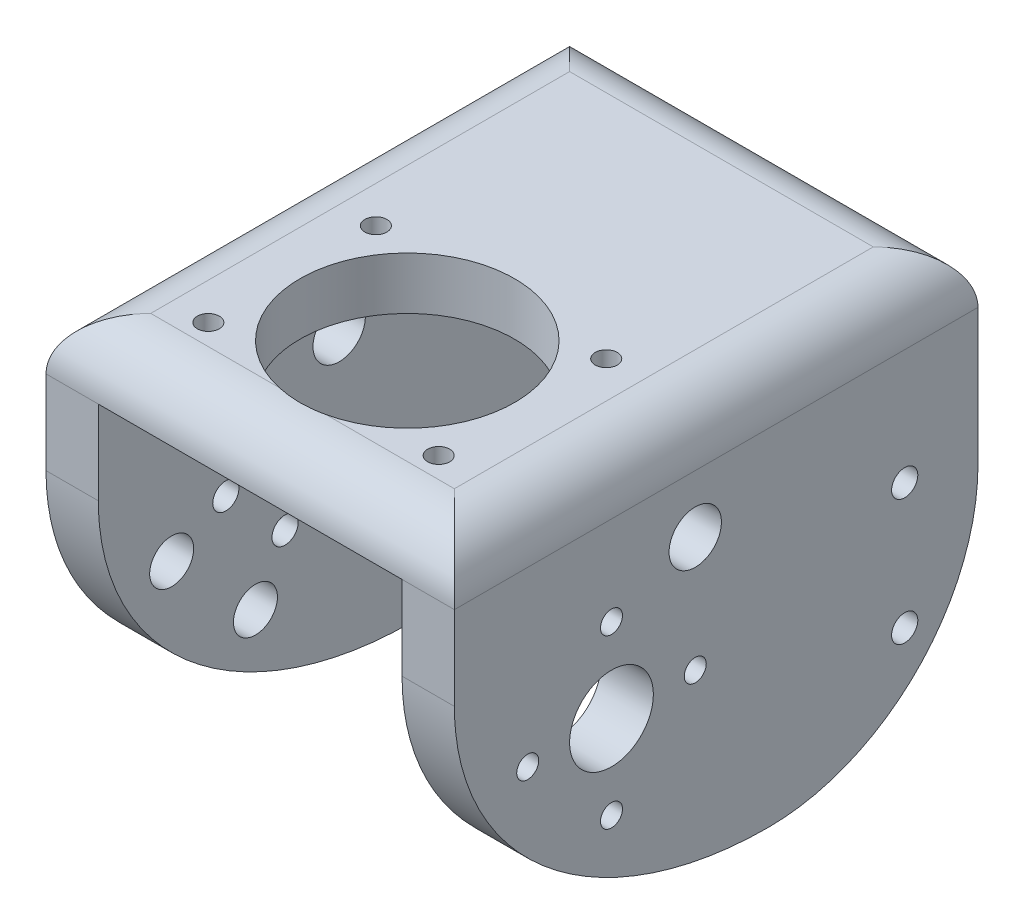
from build123d import *

# Parameters (mm, degrees)
SKETCH1_W               = 30
SKETCH1_H               = 33
SKETCH1_R               = 1.05
SKETCH1_R_2             = 4
BOSS_EXTRUDE1_DEPTH     = 5
SKETCH2_W               = 39
SKETCH2_H               = 30
SKETCH2_R               = 10.25
SKETCH2_R_2             = 1.05
BOSS_EXTRUDE2_DEPTH     = 5
SKETCH3_W               = 30
SKETCH3_H               = 38
SKETCH3_R               = 1.25
BOSS_EXTRUDE3_DEPTH     = 5
BOSS_EXTRUDE5_DEPTH     = 20
SKETCH5_R               = 1.25
CUT_EXTRUDE1_DEPTH      = 57.641415943
SKETCH7_R               = 2.5
CUT_EXTRUDE2_DEPTH      = 57.641415943
FILLET1_SIZE            = 25
FILLET1_SIZE_2          = 30
FILLET2_R               = 20
FILLET3_START           = -34
FILLET3_DEPTH           = 39
FILLET3_START_2         = -36
FILLET3_2_DEPTH         = 52
CUT_EXTRUDE3_DEPTH      = 54.322134411
CUT_EXTRUDE3_DEPTH_BACK = 2
SKETCH8_R               = 2.1


with BuildPart() as part:
    # Sketch1 → Boss-Extrude1 (new body)
    with BuildSketch(Plane(origin=(0, 0, 0), x_dir=(0, 0, -1), z_dir=(1, 0, 0))):
        Rectangle(SKETCH1_W, SKETCH1_H)
        with Locations((0, 8)):
            Circle(SKETCH1_R, mode=Mode.SUBTRACT)
        with Locations((8, 0)):
            Circle(SKETCH1_R, mode=Mode.SUBTRACT)
        with Locations((0, -8)):
            Circle(SKETCH1_R, mode=Mode.SUBTRACT)
        with Locations((-8, 0)):
            Circle(SKETCH1_R, mode=Mode.SUBTRACT)
        Circle(SKETCH1_R_2, mode=Mode.SUBTRACT)
    extrude(amount=BOSS_EXTRUDE1_DEPTH)

    # Sketch2 → Boss-Extrude2 (add)
    with BuildSketch(Plane(origin=(0, 16.5, 0), x_dir=(1, 0, 0), z_dir=(0, 1, 0))):
        with Locations((-14.5, 0)):
            Rectangle(SKETCH2_W, SKETCH2_H)
        with Locations(Location((-14.5, 0, 0), (0, 0, 270))):
            Circle(SKETCH2_R, mode=Mode.SUBTRACT)
        with Locations(Location((-25.5, 8, 0), (0, 0, 270))):
            Circle(SKETCH2_R_2, mode=Mode.SUBTRACT)
        with Locations(Location((-3.5, 8, 0), (0, 0, 270))):
            Circle(SKETCH2_R_2, mode=Mode.SUBTRACT)
        with Locations(Location((-3.5, -8, 0), (0, 0, 270))):
            Circle(SKETCH2_R_2, mode=Mode.SUBTRACT)
        with Locations(Location((-25.5, -8, 0), (0, 0, 270))):
            Circle(SKETCH2_R_2, mode=Mode.SUBTRACT)
    extrude(amount=BOSS_EXTRUDE2_DEPTH)

    # Sketch3 → Boss-Extrude3 (add)
    with BuildSketch(Plane.ZY.offset(34)):
        with Locations((0, 2.5)):
            Rectangle(SKETCH3_W, SKETCH3_H)
        with Locations((2.828427125, 2.828427125)):
            Circle(SKETCH3_R, mode=Mode.SUBTRACT)
        with Locations((-2.828427125, -2.828427125)):
            Circle(SKETCH3_R, mode=Mode.SUBTRACT)
    extrude(amount=-BOSS_EXTRUDE3_DEPTH)

    # Sketch6 → Boss-Extrude5 (add)
    with BuildSketch(Plane(origin=(0, 0, -15), x_dir=(-1, 0, 0), z_dir=(0, 0, -1))):
        Polygon((0, 16.5), (29, 16.5), (29, -16.5), (34, -16.5), (34, 21.5), (-5, 21.5), (-5, -16.5), (0, -16.5), align=None)
    extrude(amount=BOSS_EXTRUDE5_DEPTH)

    # Sketch5 → Cut-Extrude1 (cut, through all)
    with BuildSketch(Plane.ZY.offset(34)):
        with Locations((-28, -6.5)):
            Circle(SKETCH5_R)
        with Locations((-28, 5.5)):
            Circle(SKETCH5_R)
    extrude(amount=-CUT_EXTRUDE1_DEPTH, mode=Mode.SUBTRACT)

    # Sketch7 → Cut-Extrude2 (cut, through all)
    with BuildSketch(Plane.ZY.offset(34)):
        with Locations((-8, 11)):
            Circle(SKETCH7_R)
    extrude(amount=-CUT_EXTRUDE2_DEPTH, mode=Mode.SUBTRACT)

    # Fillet1
    # a fillet whose section is not a circle: 30, 25 mm, written as the material it takes off along each edge
    with BuildSketch(Plane(origin=(-109, -16.5, 15), x_dir=(0, 1, 0), z_dir=(1, 0, 0))) as fillet1_piece_1:
        with BuildLine():
            Bezier((FILLET1_SIZE, 0), (0, 0), (0, -FILLET1_SIZE_2), weights=[1, 0.707106781, 1])
            Line((0, -FILLET1_SIZE_2), (0, 0))
            Line((0, 0), (FILLET1_SIZE, 0))
        make_face()
    extrude(amount=155, mode=Mode.SUBTRACT)
    with BuildSketch(Plane(origin=(-75, -16.5, 15), x_dir=(0, 0, -1), z_dir=(1, 0, 0))) as fillet1_piece_2:
        with BuildLine():
            Bezier((FILLET1_SIZE_2, 0), (0, 0), (0, FILLET1_SIZE), weights=[1, 0.707106781, 1])
            Line((0, FILLET1_SIZE), (0, 0))
            Line((0, 0), (FILLET1_SIZE_2, 0))
        make_face()
    extrude(amount=155, mode=Mode.SUBTRACT)

    # Fillet2
    fillet2_edges = [part.edges().sort_by_distance(p)[0] for p in [
        (2.5, -16.5, -35),
        (-31.5, -16.5, -35),
    ]]
    fillet(fillet2_edges, radius=FILLET2_R - 0.0001)  # a hair under: the kernel refuses the full size

    # Fillet3: read off the stored shape, not the designer's step
    # Fillet3 outline → Fillet3 (cut)
    with BuildSketch(Plane.YZ.offset(FILLET3_START)):
        with BuildLine():
            Line((21.5, 15), (16.5, 15))
            ThreePointArc((16.5, 15), (20.035533906, 13.535533906), (21.5, 10))
            Line((21.5, 10), (21.5, 15))
        make_face()
        with BuildLine():
            Line((21.5, -35), (21.5, -30))
            ThreePointArc((21.5, -30), (20.035533906, -33.535533906), (16.5, -35))
            Line((16.5, -35), (21.5, -35))
        make_face()
    extrude(amount=FILLET3_DEPTH, mode=Mode.SUBTRACT)

    # Fillet3 2 outline → Fillet3 2 (cut)
    with BuildSketch(Plane.XY.offset(FILLET3_START_2)):
        with BuildLine():
            Line((-34, 21.5), (-34, 16.5))
            ThreePointArc((-34, 16.5), (-32.535533906, 20.035533906), (-29, 21.5))
            Line((-29, 21.5), (-34, 21.5))
        make_face()
        with BuildLine():
            Line((5, 21.5), (0, 21.5))
            ThreePointArc((0, 21.5), (3.535533906, 20.035533906), (5, 16.5))
            Line((5, 16.5), (5, 21.5))
        make_face()
    extrude(amount=FILLET3_2_DEPTH, mode=Mode.SUBTRACT)

    # Sketch8 → Cut-Extrude3 (cut, two sides: drawn at the far end of the back side and taken through both)
    with BuildSketch(Plane.ZY.offset(-CUT_EXTRUDE3_DEPTH_BACK)):
        with Locations(Location((0, 8, 0), (0, 0, 180))):
            Circle(SKETCH8_R)
        with Locations(Location((8, 0, 0), (0, 0, 180))):
            Circle(SKETCH8_R)
        with Locations(Location((0, -8, 0), (0, 0, 180))):
            Circle(SKETCH8_R)
        with Locations(Location((-8, 0, 0), (0, 0, 180))):
            Circle(SKETCH8_R)
    extrude(amount=CUT_EXTRUDE3_DEPTH + CUT_EXTRUDE3_DEPTH_BACK, mode=Mode.SUBTRACT)


solid = part.part
